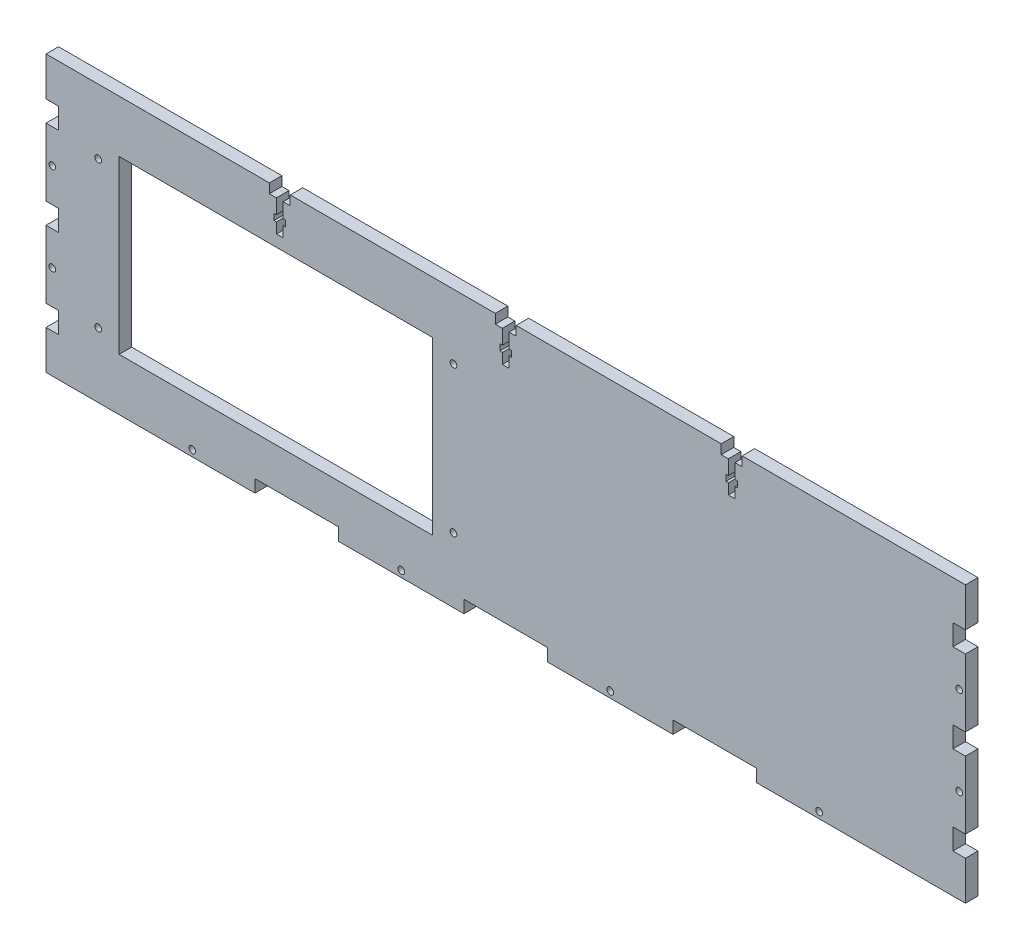
from build123d import *

# Parameters (mm, degrees)
SKETCH1_W           = 440
SKETCH1_H           = 132
BOSS_EXTRUDE1_DEPTH = 6
CUT_EXTRUDE1_REACH  = 231.765
SKETCH2_R           = 1.6
SKETCH2_W           = 6
SKETCH2_H           = 10
CUT_EXTRUDE2_REACH  = 231.765
SKETCH3_R           = 1.6
CUT_EXTRUDE3_REACH  = 231.765
SKETCH4_W           = 40
SKETCH4_H           = 6
SKETCH5_W           = 10
SKETCH5_H           = 6
CUT_EXTRUDE4_DEPTH  = 4.5
CUT_EXTRUDE5_REACH  = 231.765
SKETCH7_R           = 1.6
SKETCH7_W           = 150
SKETCH7_H           = 82
CUT_EXTRUDE6_DEPTH  = 230.765097436


with BuildPart() as part:
    # Sketch1 → Boss-Extrude1 (new body)
    with BuildSketch(Plane.XY):
        Rectangle(SKETCH1_W, SKETCH1_H)
    extrude(amount=BOSS_EXTRUDE1_DEPTH)

    # Sketch2 → Cut-Extrude1 (cut, up to next)
    with BuildSketch(Plane(origin=(0, 0, 0), x_dir=(-1, 0, 0), z_dir=(0, 0, -1)), mode=Mode.PRIVATE) as cut_extrude1_sk1:
        with Locations((217, 21.166064391)):
            Circle(SKETCH2_R)
    cut_extrude1_tool1 = extrude(cut_extrude1_sk1.sketch, amount=-CUT_EXTRUDE1_REACH, mode=Mode.PRIVATE) & part.part
    # Sketch2 → Cut-Extrude1 (cut, up to next)
    with BuildSketch(Plane(origin=(0, 0, 0), x_dir=(-1, 0, 0), z_dir=(0, 0, -1)), mode=Mode.PRIVATE) as cut_extrude1_sk2:
        with Locations((217, -21.166064391)):
            Circle(SKETCH2_R)
    cut_extrude1_tool2 = extrude(cut_extrude1_sk2.sketch, amount=-CUT_EXTRUDE1_REACH, mode=Mode.PRIVATE) & part.part
    # Sketch2 → Cut-Extrude1 (cut, up to next)
    with BuildSketch(Plane(origin=(0, 0, 0), x_dir=(-1, 0, 0), z_dir=(0, 0, -1)), mode=Mode.PRIVATE) as cut_extrude1_sk3:
        with Locations((-217, 21.166064391)):
            Circle(SKETCH2_R)
    cut_extrude1_tool3 = extrude(cut_extrude1_sk3.sketch, amount=-CUT_EXTRUDE1_REACH, mode=Mode.PRIVATE) & part.part
    # Sketch2 → Cut-Extrude1 (cut, up to next)
    with BuildSketch(Plane(origin=(0, 0, 0), x_dir=(-1, 0, 0), z_dir=(0, 0, -1)), mode=Mode.PRIVATE) as cut_extrude1_sk4:
        with Locations((-217, -21.166064391)):
            Circle(SKETCH2_R)
    cut_extrude1_tool4 = extrude(cut_extrude1_sk4.sketch, amount=-CUT_EXTRUDE1_REACH, mode=Mode.PRIVATE) & part.part
    # Sketch2 → Cut-Extrude1 (cut, up to next)
    with BuildSketch(Plane(origin=(0, 0, 0), x_dir=(-1, 0, 0), z_dir=(0, 0, -1)), mode=Mode.PRIVATE) as cut_extrude1_sk5:
        with Locations((217, 42.332128782)):
            Rectangle(SKETCH2_W, SKETCH2_H)
    cut_extrude1_tool5 = extrude(cut_extrude1_sk5.sketch, amount=-CUT_EXTRUDE1_REACH, mode=Mode.PRIVATE) & part.part
    # Sketch2 → Cut-Extrude1 (cut, up to next)
    with BuildSketch(Plane(origin=(0, 0, 0), x_dir=(-1, 0, 0), z_dir=(0, 0, -1)), mode=Mode.PRIVATE) as cut_extrude1_sk6:
        with Locations((217, -42.332128782)):
            Rectangle(SKETCH2_W, SKETCH2_H)
    cut_extrude1_tool6 = extrude(cut_extrude1_sk6.sketch, amount=-CUT_EXTRUDE1_REACH, mode=Mode.PRIVATE) & part.part
    # Sketch2 → Cut-Extrude1 (cut, up to next)
    with BuildSketch(Plane(origin=(0, 0, 0), x_dir=(-1, 0, 0), z_dir=(0, 0, -1)), mode=Mode.PRIVATE) as cut_extrude1_sk7:
        with Locations((-217, -42.332128782)):
            Rectangle(SKETCH2_W, SKETCH2_H)
    cut_extrude1_tool7 = extrude(cut_extrude1_sk7.sketch, amount=-CUT_EXTRUDE1_REACH, mode=Mode.PRIVATE) & part.part
    # Sketch2 → Cut-Extrude1 (cut, up to next)
    with BuildSketch(Plane(origin=(0, 0, 0), x_dir=(-1, 0, 0), z_dir=(0, 0, -1)), mode=Mode.PRIVATE) as cut_extrude1_sk8:
        with Locations((-217, 42.332128782)):
            Rectangle(SKETCH2_W, SKETCH2_H)
    cut_extrude1_tool8 = extrude(cut_extrude1_sk8.sketch, amount=-CUT_EXTRUDE1_REACH, mode=Mode.PRIVATE) & part.part
    # Sketch2 → Cut-Extrude1 (cut, up to next)
    with BuildSketch(Plane(origin=(0, 0, 0), x_dir=(-1, 0, 0), z_dir=(0, 0, -1)), mode=Mode.PRIVATE) as cut_extrude1_sk9:
        with Locations((217, 0)):
            Rectangle(SKETCH2_W, SKETCH2_H)
    cut_extrude1_tool9 = extrude(cut_extrude1_sk9.sketch, amount=-CUT_EXTRUDE1_REACH, mode=Mode.PRIVATE) & part.part
    # Sketch2 → Cut-Extrude1 (cut, up to next)
    with BuildSketch(Plane(origin=(0, 0, 0), x_dir=(-1, 0, 0), z_dir=(0, 0, -1)), mode=Mode.PRIVATE) as cut_extrude1_sk10:
        with Locations((-217, 0)):
            Rectangle(SKETCH2_W, SKETCH2_H)
    cut_extrude1_tool10 = extrude(cut_extrude1_sk10.sketch, amount=-CUT_EXTRUDE1_REACH, mode=Mode.PRIVATE) & part.part
    add(cut_extrude1_tool1.solids().sort_by_distance((-217, 21.166064, 0))[0], mode=Mode.SUBTRACT)
    add(cut_extrude1_tool2.solids().sort_by_distance((-217, -21.166064, 0))[0], mode=Mode.SUBTRACT)
    add(cut_extrude1_tool3.solids().sort_by_distance((217, 21.166064, 0))[0], mode=Mode.SUBTRACT)
    add(cut_extrude1_tool4.solids().sort_by_distance((217, -21.166064, 0))[0], mode=Mode.SUBTRACT)
    add(cut_extrude1_tool5.solids().sort_by_distance((-217, 42.332129, 0))[0], mode=Mode.SUBTRACT)
    add(cut_extrude1_tool6.solids().sort_by_distance((-217, -42.332129, 0))[0], mode=Mode.SUBTRACT)
    add(cut_extrude1_tool7.solids().sort_by_distance((217, -42.332129, 0))[0], mode=Mode.SUBTRACT)
    add(cut_extrude1_tool8.solids().sort_by_distance((217, 42.332129, 0))[0], mode=Mode.SUBTRACT)
    add(cut_extrude1_tool9.solids().sort_by_distance((-217, 0, 0))[0], mode=Mode.SUBTRACT)
    add(cut_extrude1_tool10.solids().sort_by_distance((217, 0, 0))[0], mode=Mode.SUBTRACT)

    # Sketch3 → Cut-Extrude2 (cut, up to next)
    with BuildSketch(Plane(origin=(0, 0, 0), x_dir=(-1, 0, 0), z_dir=(0, 0, -1)), mode=Mode.PRIVATE) as cut_extrude2_sk1:
        with Locations((-150, -63)):
            Circle(SKETCH3_R)
    cut_extrude2_tool1 = extrude(cut_extrude2_sk1.sketch, amount=-CUT_EXTRUDE2_REACH, mode=Mode.PRIVATE) & part.part
    # Sketch3 → Cut-Extrude2 (cut, up to next)
    with BuildSketch(Plane(origin=(0, 0, 0), x_dir=(-1, 0, 0), z_dir=(0, 0, -1)), mode=Mode.PRIVATE) as cut_extrude2_sk2:
        with Locations((-50, -63)):
            Circle(SKETCH3_R)
    cut_extrude2_tool2 = extrude(cut_extrude2_sk2.sketch, amount=-CUT_EXTRUDE2_REACH, mode=Mode.PRIVATE) & part.part
    # Sketch3 → Cut-Extrude2 (cut, up to next)
    with BuildSketch(Plane(origin=(0, 0, 0), x_dir=(-1, 0, 0), z_dir=(0, 0, -1)), mode=Mode.PRIVATE) as cut_extrude2_sk3:
        with Locations((50, -63)):
            Circle(SKETCH3_R)
    cut_extrude2_tool3 = extrude(cut_extrude2_sk3.sketch, amount=-CUT_EXTRUDE2_REACH, mode=Mode.PRIVATE) & part.part
    # Sketch3 → Cut-Extrude2 (cut, up to next)
    with BuildSketch(Plane(origin=(0, 0, 0), x_dir=(-1, 0, 0), z_dir=(0, 0, -1)), mode=Mode.PRIVATE) as cut_extrude2_sk4:
        with Locations((150, -63)):
            Circle(SKETCH3_R)
    cut_extrude2_tool4 = extrude(cut_extrude2_sk4.sketch, amount=-CUT_EXTRUDE2_REACH, mode=Mode.PRIVATE) & part.part
    add(cut_extrude2_tool1.solids().sort_by_distance((150, -63, 0))[0], mode=Mode.SUBTRACT)
    add(cut_extrude2_tool2.solids().sort_by_distance((50, -63, 0))[0], mode=Mode.SUBTRACT)
    add(cut_extrude2_tool3.solids().sort_by_distance((-50, -63, 0))[0], mode=Mode.SUBTRACT)
    add(cut_extrude2_tool4.solids().sort_by_distance((-150, -63, 0))[0], mode=Mode.SUBTRACT)

    # Sketch4 → Cut-Extrude3 (cut, up to next)
    with BuildSketch(Plane(origin=(0, 0, 0), x_dir=(-1, 0, 0), z_dir=(0, 0, -1)), mode=Mode.PRIVATE) as cut_extrude3_sk1:
        with Locations((100, -63)):
            Rectangle(SKETCH4_W, SKETCH4_H)
    cut_extrude3_tool1 = extrude(cut_extrude3_sk1.sketch, amount=-CUT_EXTRUDE3_REACH, mode=Mode.PRIVATE) & part.part
    # Sketch4 → Cut-Extrude3 (cut, up to next)
    with BuildSketch(Plane(origin=(0, 0, 0), x_dir=(-1, 0, 0), z_dir=(0, 0, -1)), mode=Mode.PRIVATE) as cut_extrude3_sk2:
        with Locations((0, -63)):
            Rectangle(SKETCH4_W, SKETCH4_H)
    cut_extrude3_tool2 = extrude(cut_extrude3_sk2.sketch, amount=-CUT_EXTRUDE3_REACH, mode=Mode.PRIVATE) & part.part
    # Sketch4 → Cut-Extrude3 (cut, up to next)
    with BuildSketch(Plane(origin=(0, 0, 0), x_dir=(-1, 0, 0), z_dir=(0, 0, -1)), mode=Mode.PRIVATE) as cut_extrude3_sk3:
        with Locations((-100, -63)):
            Rectangle(SKETCH4_W, SKETCH4_H)
    cut_extrude3_tool3 = extrude(cut_extrude3_sk3.sketch, amount=-CUT_EXTRUDE3_REACH, mode=Mode.PRIVATE) & part.part
    add(cut_extrude3_tool1.solids().sort_by_distance((-100, -63, 0))[0], mode=Mode.SUBTRACT)
    add(cut_extrude3_tool2.solids().sort_by_distance((0, -63, 0))[0], mode=Mode.SUBTRACT)
    add(cut_extrude3_tool3.solids().sort_by_distance((100, -63, 0))[0], mode=Mode.SUBTRACT)

    # Sketch5 → Cut-Extrude4 (cut)
    with BuildSketch(Plane(origin=(0, 66, 0), x_dir=(1, 0, 0), z_dir=(0, 1, 0))):
        with Locations((-108.125, -3)):
            Rectangle(SKETCH5_W, SKETCH5_H)
        with Locations((0, -3)):
            Rectangle(SKETCH5_W, SKETCH5_H)
        with Locations((108.125, -3)):
            Rectangle(SKETCH5_W, SKETCH5_H)
    extrude(amount=-CUT_EXTRUDE4_DEPTH, mode=Mode.SUBTRACT)

    # Sketch6 → Cut-Extrude5 (cut, up to next)
    with BuildSketch(Plane(origin=(0, 0, 0), x_dir=(-1, 0, 0), z_dir=(0, 0, -1)), mode=Mode.PRIVATE) as cut_extrude5_sk1:
        Polygon((-109.725, 61.5), (-109.725, 54.5), (-110.925, 54.5), (-110.925, 51.5), (-109.725, 51.5), (-109.725, 46.5), (-106.525, 46.5), (-106.525, 51.5), (-105.325, 51.5), (-105.325, 54.5), (-106.525, 54.5), (-106.525, 61.5), align=None)
    cut_extrude5_tool1 = extrude(cut_extrude5_sk1.sketch, amount=-CUT_EXTRUDE5_REACH, mode=Mode.PRIVATE) & part.part
    # Sketch6 → Cut-Extrude5 (cut, up to next)
    with BuildSketch(Plane(origin=(0, 0, 0), x_dir=(-1, 0, 0), z_dir=(0, 0, -1)), mode=Mode.PRIVATE) as cut_extrude5_sk2:
        Polygon((-1.595, 61.5), (-1.595, 54.5), (-2.795, 54.5), (-2.795, 51.5), (-1.595, 51.5), (-1.595, 46.5), (1.605, 46.5), (1.605, 51.5), (2.805, 51.5), (2.805, 54.5), (1.605, 54.5), (1.605, 61.5), align=None)
    cut_extrude5_tool2 = extrude(cut_extrude5_sk2.sketch, amount=-CUT_EXTRUDE5_REACH, mode=Mode.PRIVATE) & part.part
    # Sketch6 → Cut-Extrude5 (cut, up to next)
    with BuildSketch(Plane(origin=(0, 0, 0), x_dir=(-1, 0, 0), z_dir=(0, 0, -1)), mode=Mode.PRIVATE) as cut_extrude5_sk3:
        Polygon((106.535, 61.5), (106.535, 54.5), (105.335, 54.5), (105.335, 51.5), (106.535, 51.5), (106.535, 46.5), (109.735, 46.5), (109.735, 51.5), (110.935, 51.5), (110.935, 54.5), (109.735, 54.5), (109.735, 61.5), align=None)
    cut_extrude5_tool3 = extrude(cut_extrude5_sk3.sketch, amount=-CUT_EXTRUDE5_REACH, mode=Mode.PRIVATE) & part.part
    add(cut_extrude5_tool1.solids().sort_by_distance((108.125, 53.869565, 0))[0], mode=Mode.SUBTRACT)
    add(cut_extrude5_tool2.solids().sort_by_distance((-0.005, 53.869565, 0))[0], mode=Mode.SUBTRACT)
    add(cut_extrude5_tool3.solids().sort_by_distance((-108.135, 53.869565, 0))[0], mode=Mode.SUBTRACT)

    # Sketch7 → Cut-Extrude6 (cut, through all)
    with BuildSketch(Plane(origin=(0, 0, 0), x_dir=(-1, 0, 0), z_dir=(0, 0, -1))):
        with Locations((25, 35)):
            Circle(SKETCH7_R)
        with Locations((25, -35)):
            Circle(SKETCH7_R)
        with Locations((195, 35)):
            Circle(SKETCH7_R)
        with Locations((195, -35)):
            Circle(SKETCH7_R)
        with Locations((110, 0)):
            Rectangle(SKETCH7_W, SKETCH7_H)
    extrude(amount=-CUT_EXTRUDE6_DEPTH, mode=Mode.SUBTRACT)


solid = part.part
